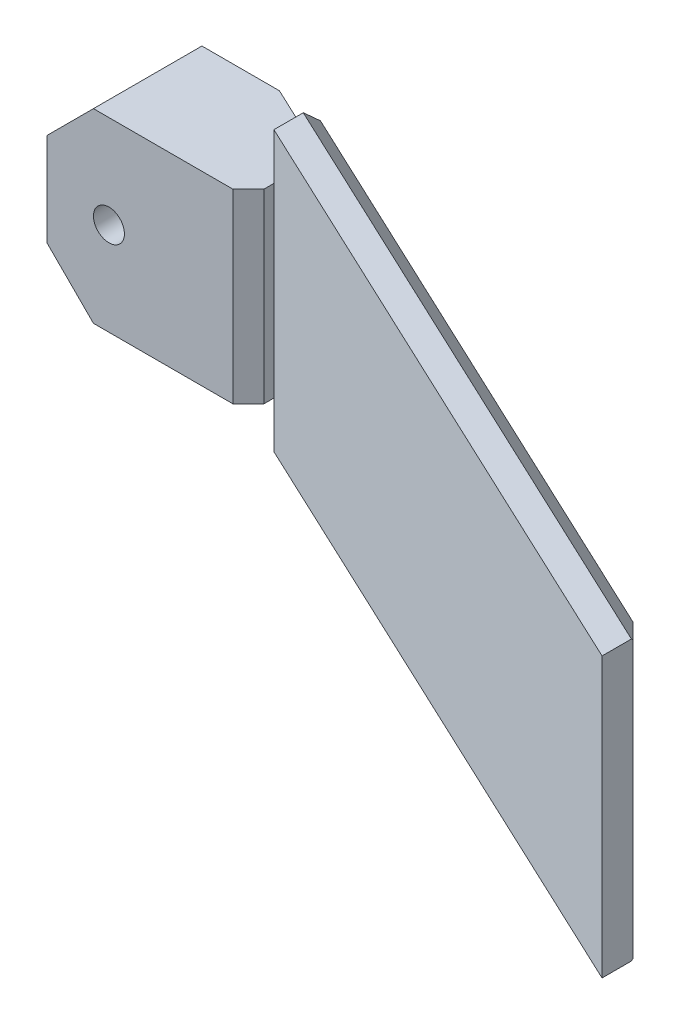
from build123d import *

# Parameters (mm, degrees)
SALIENTE_EXTRUIR1_DEPTH = 18
CROQUIS2_R              = 2.5
CORTAR_EXTRUIR1_DEPTH   = 2.5
CROQUIS3_W              = 13
CROQUIS3_H              = 3
CORTAR_EXTRUIR2_DEPTH   = 58.528268965
CHAFL_N1_SIZE           = 1
CHAFL_N2_SIZE           = 1
CHAFL_N2_SIZE2          = 2.087588248
CROQUIS4_W              = 13
CROQUIS4_H              = 12
SALIENTE_EXTRUIR2_DEPTH = 4
CROQUIS5_R              = 1
CORTAR_EXTRUIR3_DEPTH   = 57.523175576
CHAFL_N3_SIZE           = 3
CHAFL_N4_SIZE           = 1


with BuildPart() as part:
    # Croquis1 → Saliente-Extruir1 (new body)
    with BuildSketch(Plane(origin=(0, 0, 0), x_dir=(1, 0, 0), z_dir=(0, 1, 0))):
        Polygon((4, -1.5), (49, -22.676470588), (49, -19.676470588), (4, 1.5), (-4, 1.5), (-4, -1.5), align=None)
    extrude(amount=SALIENTE_EXTRUIR1_DEPTH)

    # Croquis2 → Cortar-Extruir1 (cut)
    with BuildSketch(Plane(origin=(0, 0, -1.5), x_dir=(-1, 0, 0), z_dir=(0, 0, -1))):
        with Locations((0, 9)):
            Circle(CROQUIS2_R)
    extrude(amount=-CORTAR_EXTRUIR1_DEPTH, mode=Mode.SUBTRACT)

    # Croquis3 → Cortar-Extruir2 (cut, through all)
    with BuildSketch(Plane(origin=(0, 0, -1.5), x_dir=(-1, 0, 0), z_dir=(0, 0, -1))):
        with Locations((-2.5, 16.5)):
            Rectangle(CROQUIS3_W, CROQUIS3_H)
        with Locations((-2.5, 1.5)):
            Rectangle(CROQUIS3_W, CROQUIS3_H)
    extrude(amount=-CORTAR_EXTRUIR2_DEPTH, mode=Mode.SUBTRACT)

    # Chaflán1
    chafl_n1_edges = [part.edges().sort_by_distance(p)[0] for p in [
        (29, 0, 10.264705882),
        (29, 18, 10.264705882),
    ]]
    chamfer(chafl_n1_edges, length=CHAFL_N1_SIZE)

    # Chaflán2
    chafl_n2_edges = [part.edges().sort_by_distance(p)[0] for p in [
        (49, 9, 19.676470588),
    ]]
    chafl_n2_side = [part.faces().sort_by_distance(p)[0] for p in [
        (49, 9, 21.200114489),
    ]]
    chamfer(chafl_n2_edges, length=CHAFL_N2_SIZE, length2=CHAFL_N2_SIZE2, reference=chafl_n2_side[0])

    # Croquis4 → Saliente-Extruir2 (add)
    with BuildSketch(Plane.XY.offset(1.5)):
        with Locations((2.5, 9)):
            Rectangle(CROQUIS4_W, CROQUIS4_H)
    extrude(amount=SALIENTE_EXTRUIR2_DEPTH)

    # Croquis5 → Cortar-Extruir3 (cut, through all)
    with BuildSketch(Plane(origin=(0, 0, 1), x_dir=(-1, 0, 0), z_dir=(0, 0, -1))):
        with Locations((0, 9)):
            Circle(CROQUIS5_R)
    extrude(amount=-CORTAR_EXTRUIR3_DEPTH, mode=Mode.SUBTRACT)

    # Chaflán3
    chafl_n3_edges = [part.edges().sort_by_distance(p)[0] for p in [
        (-4, 15, 2),
        (-4, 3, 2),
    ]]
    chamfer(chafl_n3_edges, length=CHAFL_N3_SIZE)

    # Chaflán4
    chafl_n4_edges = [part.edges().sort_by_distance(p)[0] for p in [
        (9, 9, 5.5),
    ]]
    chamfer(chafl_n4_edges, length=CHAFL_N4_SIZE)


solid = part.part
